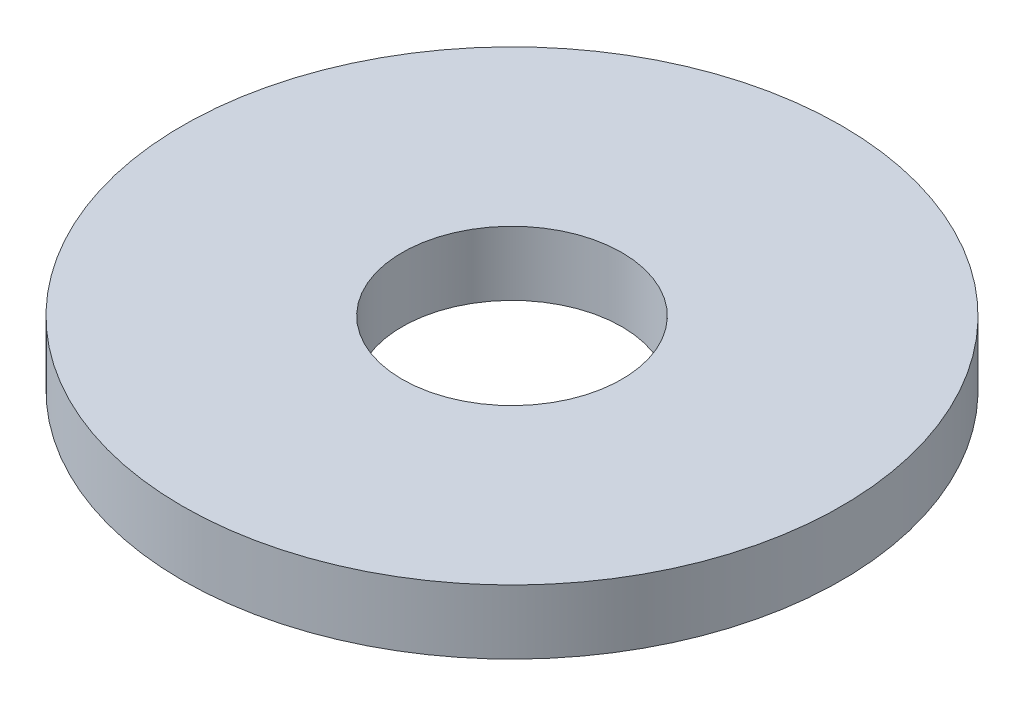
from build123d import *

# Parameters (mm, degrees)
SKETCH1_R           = 97.5
BOSS_EXTRUDE1_DEPTH = 19
SKETCH2_R           = 32.5
CUT_EXTRUDE1_DEPTH  = 140.188720807


with BuildPart() as part:
    # Sketch1 → Boss-Extrude1 (new body)
    with BuildSketch(Plane(origin=(0, 0, 0), x_dir=(1, 0, 0), z_dir=(0, 1, 0))):
        Circle(SKETCH1_R)
    extrude(amount=BOSS_EXTRUDE1_DEPTH)

    # Sketch2 → Cut-Extrude1 (cut, through all)
    with BuildSketch(Plane(origin=(0, 0, 0), x_dir=(1, 0, 0), z_dir=(0, 1, 0))):
        Circle(SKETCH2_R)
    extrude(amount=CUT_EXTRUDE1_DEPTH, mode=Mode.SUBTRACT)


solid = part.part
